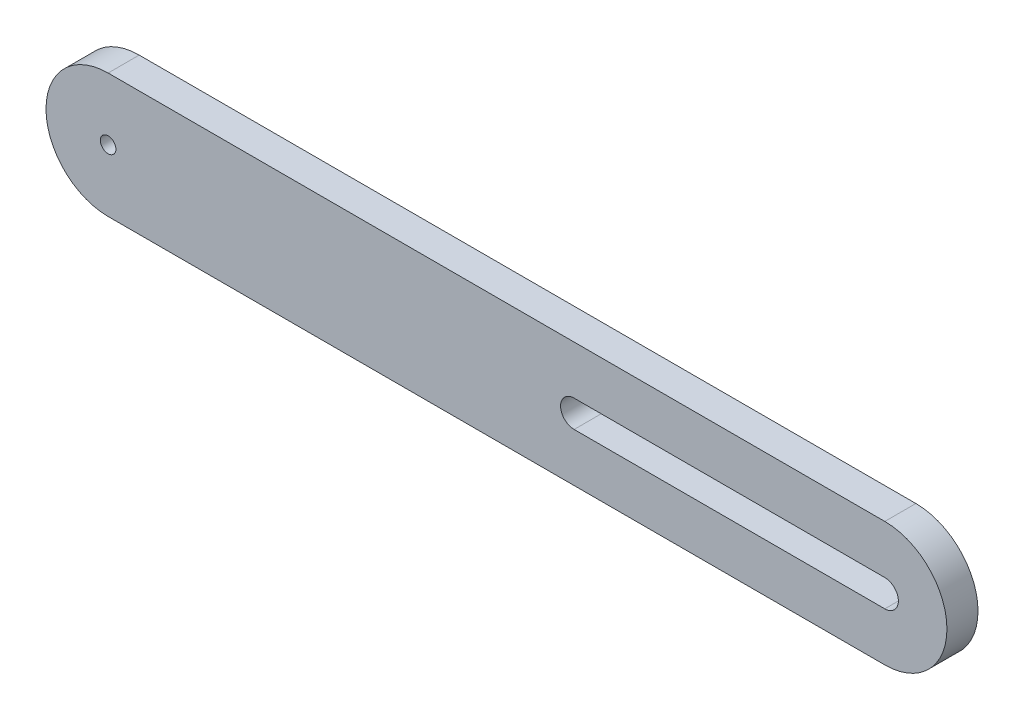
from build123d import *

# Parameters (mm, degrees)
BOSS_EXTRUDE1_DEPTH     = 2.54
SKETCH2_R               = 0.635
CUT_EXTRUDE1_DEPTH      = 69.814783295
CUT_EXTRUDE2_DEPTH      = 69.814783295
CUT_EXTRUDE2_DEPTH_BACK = 69.814783295


with BuildPart() as part:
    # Sketch1 → Boss-Extrude1 (new body)
    with BuildSketch(Plane.XY):
        with BuildLine():
            Line((0, 5.08), (63.5, 5.08))
            ThreePointArc((63.5, 5.08), (68.58, 0), (63.5, -5.08))
            Line((63.5, -5.08), (0, -5.08))
            ThreePointArc((0, -5.08), (-5.08, 0), (0, 5.08))
        make_face()
    extrude(amount=BOSS_EXTRUDE1_DEPTH)

    # Sketch2 → Cut-Extrude1 (cut, symmetric)
    with BuildSketch(Plane.XY.offset(2.54)):
        Circle(SKETCH2_R)
    cut_extrude1 = extrude(amount=CUT_EXTRUDE1_DEPTH, both=True, mode=Mode.SUBTRACT)

    # Mirror1: Cut-Extrude1 across plane
    add(cut_extrude1.mirror(Plane(origin=(31.75, 0, 0), x_dir=(0, 0, 1), z_dir=(1, 0, 0))), mode=Mode.SUBTRACT)

    # Sketch4 → Cut-Extrude2 (cut, two sides: drawn at the far end of the back side and taken through both)
    with BuildSketch(Plane.XY.offset(2.54).offset(-CUT_EXTRUDE2_DEPTH_BACK)):
        with BuildLine():
            Line((63.5, -1.107976508), (38.09873006, -1.107976508))
            ThreePointArc((38.09873006, -1.107976508), (36.990753552, 0), (38.09873006, 1.107976508))
            Line((38.09873006, 1.107976508), (63.5, 1.107976508))
            ThreePointArc((63.5, 1.107976508), (64.607976508, 0), (63.5, -1.107976508))
        make_face()
    extrude(amount=CUT_EXTRUDE2_DEPTH + CUT_EXTRUDE2_DEPTH_BACK, mode=Mode.SUBTRACT)


solid = part.part
